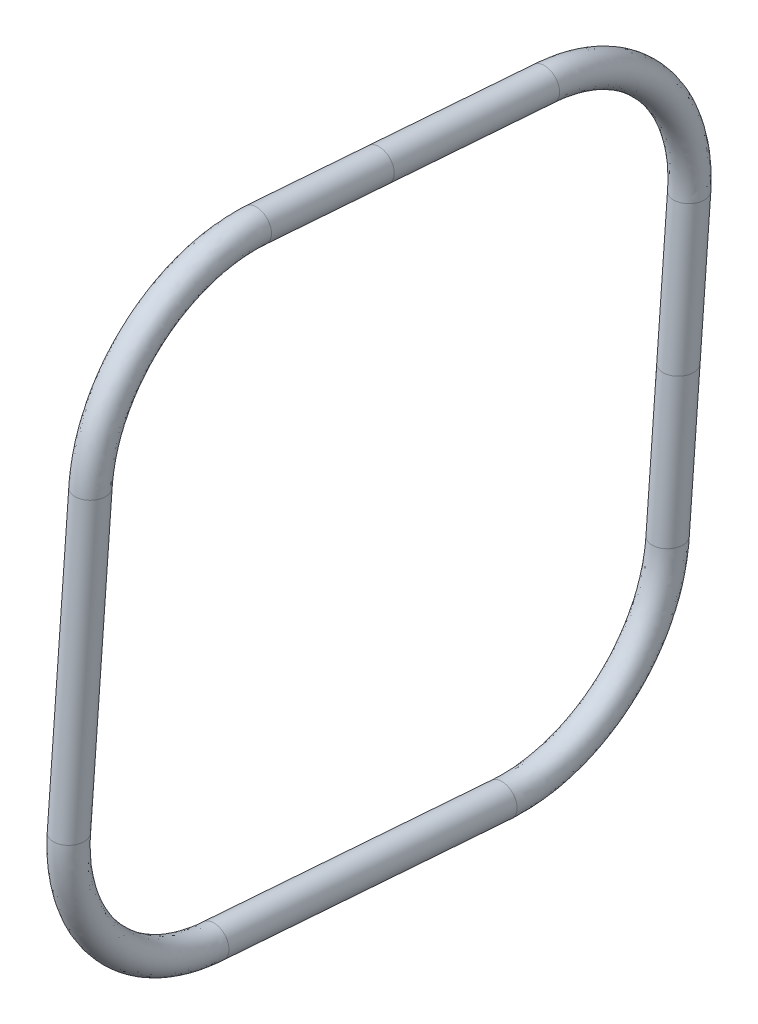
from build123d import *

# Parameters (mm, degrees)
SKETCH3_RX = 1.7653
SKETCH3_RY = 1.7399


with BuildPart() as part:
    # Sweep3: sweep along a path in Sketch4
    with BuildLine(Plane(origin=(0, 0, 0), x_dir=(0, 0, -1), z_dir=(1, 0, 0))) as sweep3_path:
        Line((-33.647493482, -14.019320478), (-31.184947754, 18.873107796))
        ThreePointArc((-31.184947754, 18.873107796), (-25.662009579, 29.815418451), (-14.019320478, 33.647493482))
        Line((-14.019320478, 33.647493482), (18.873107796, 31.184947754))
        ThreePointArc((18.873107796, 31.184947754), (29.815418451, 25.662009579), (33.647493482, 14.019320478))
        Line((33.647493482, 14.019320478), (32.416220618, -2.426893659))
        Line((32.416220618, -2.426893659), (31.184947754, -18.873107796))
        ThreePointArc((31.184947754, -18.873107796), (25.662009579, -29.815418451), (14.019320478, -33.647493482))
        Line((14.019320478, -33.647493482), (-18.873107796, -31.184947754))
        ThreePointArc((-18.873107796, -31.184947754), (-29.815418451, -25.662009579), (-33.647493482, -14.019320478))
    # Sketch3 → Sweep3 (sweep)
    with BuildSketch(Plane.XY):
        with Locations(Location((0, 34.363214002), (0, 0, -90))):
            Ellipse(SKETCH3_RX, SKETCH3_RY)
    sweep(path=sweep3_path.line)


solid = part.part
